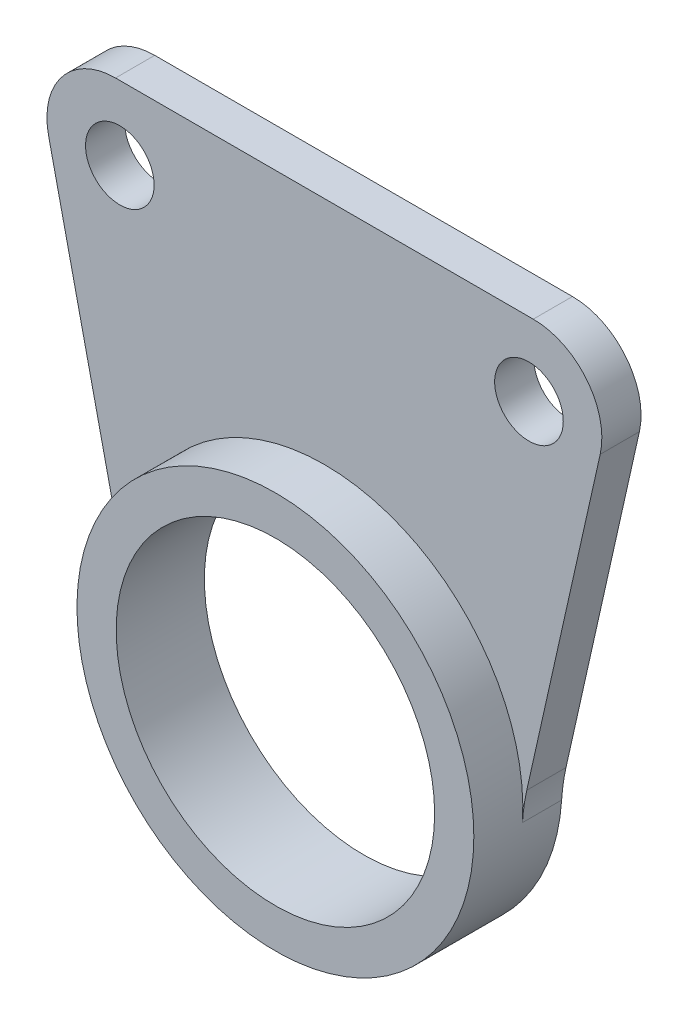
from build123d import *

# Parameters (mm, degrees)
ESQUISSE1_R        = 10.125
ESQUISSE1_R_2      = 8.125
BOSS_EXTRU_1_DEPTH = 4.5
ESQUISSE1_3_R      = 1.75
BOSS_EXTRU_2_DEPTH = 2
CONG_1_R           = 3.5
CONG_2_R           = 10


with BuildPart() as part:
    # Esquisse1 → Boss.-Extru.1 (new body)
    with BuildSketch(Plane.XY):
        Circle(ESQUISSE1_R)
        Circle(ESQUISSE1_R_2, mode=Mode.SUBTRACT)
    extrude(amount=BOSS_EXTRU_1_DEPTH)

    # Esquisse1<3> → Boss.-Extru.2 (add)
    with BuildSketch(Plane.XY):
        with BuildLine():
            Line((-15.028017241, 21.875), (-10.125, 0))
            ThreePointArc((-10.125, 0), (0, 10.125), (10.125, 0))
            Line((10.125, 0), (15.028017241, 21.875))
            Line((15.028017241, 21.875), (-15.028017241, 21.875))
        make_face()
        with Locations((-10.4375, 18.125)):
            Circle(ESQUISSE1_3_R, mode=Mode.SUBTRACT)
        with Locations((10.4375, 18.125)):
            Circle(ESQUISSE1_3_R, mode=Mode.SUBTRACT)
    extrude(amount=BOSS_EXTRU_2_DEPTH)

    # Congé1
    cong_1_edges = [part.edges().sort_by_distance(p)[0] for p in [
        (15.028017241, 21.875, 1),
        (-15.028017241, 21.875, 1),
    ]]
    fillet(cong_1_edges, radius=CONG_1_R)

    # Congé2
    # the kernel refuses this fillet: 10 mm, written as the material it adds along each edge
    with BuildSketch(Plane(origin=(-10.125, 0, 0), x_dir=(0.03212219246103637, -0.9994839492215452, 0), z_dir=(0, 0, 1))) as cong_2_piece_1:
        with BuildLine():
            CenterArc((0.971696322, -9.994839492), CONG_2_R, 91.840782713, 8.951796508)
            Line((-0.900844579, -0.171724377), (0, 0))
            ThreePointArc((0, 0), (0.325237199, -0.005225014), (0.650474397, 0))
        make_face()
    extrude(amount=2)
    with BuildSketch(Plane(origin=(10.125, 0, 0), x_dir=(0.21871145691738353, 0.9757895770160058, 0), z_dir=(0, 0, 1))) as cong_2_piece_2:
        with BuildLine():
            CenterArc((0.917066092, -10), CONG_2_R, 90, 8.951796508)
            ThreePointArc((-0.638968488, -0.121803991), (-0.318505839, -0.066034587), (0, 0))
            Line((0, 0), (0.917066092, 0))
        make_face()
    extrude(amount=2)


solid = part.part
